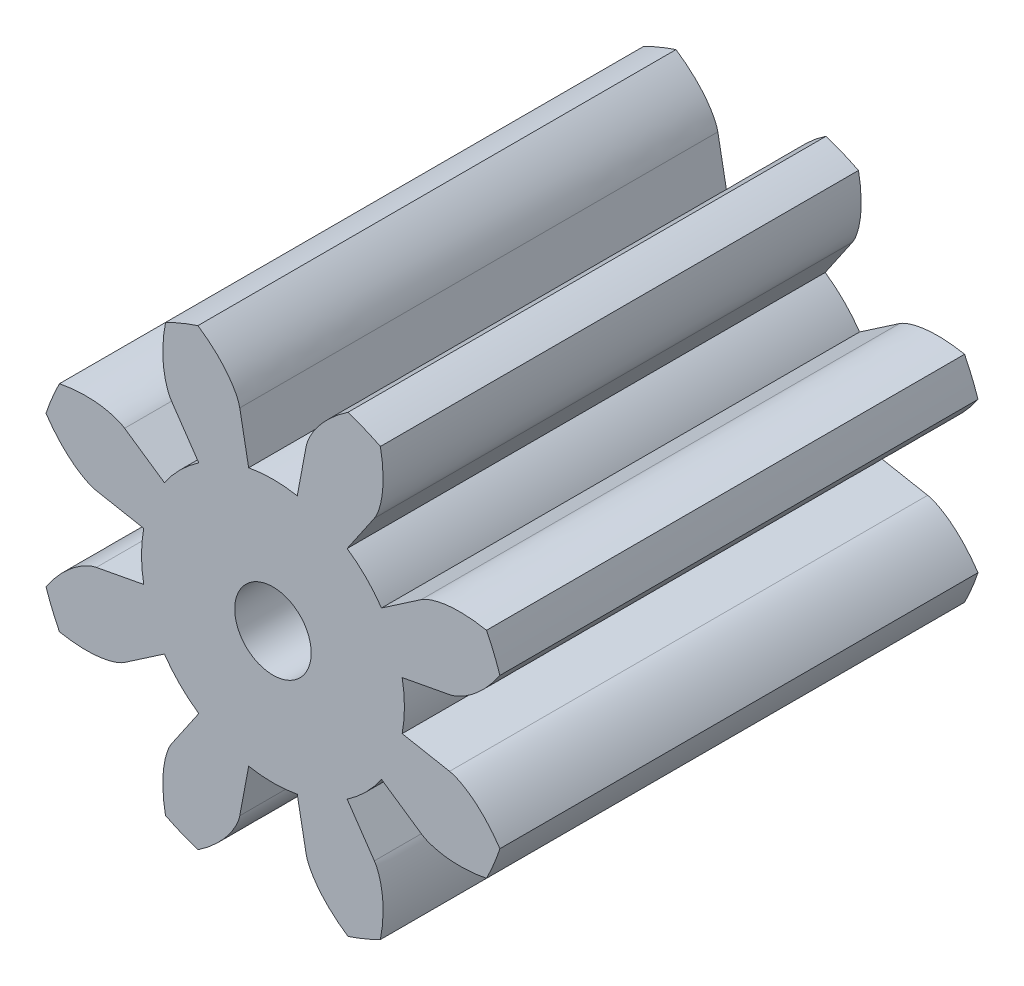
from build123d import *

# Parameters (mm, degrees)
SKETCH_1_R               = 2.5
SKETCH_1_R_2             = 0.4
EXTRUDE_1_DEPTH          = 5
CUT_EXTRUDE_1_DEPTH      = 7.123724357
PATTERN_CIRCULAR_1_COUNT = 8
PATTERN_CIRCULAR_1_ANGLE = 315


with BuildPart() as part:
    # 草图1 → 凸台-拉伸1 (new body)
    with BuildSketch(Plane.XY):
        Circle(SKETCH_1_R)
        Circle(SKETCH_1_R_2, mode=Mode.SUBTRACT)
    extrude(amount=EXTRUDE_1_DEPTH)

    # 草图1<3> → 切除-拉伸1 (cut, through all)
    with BuildSketch(Plane.XY):
        with BuildLine():
            Line((1.847026432, 0.347249544), (1.351325576, 0.254055481))
            ThreePointArc((1.351325576, 0.254055481), (1.369068601, 0.12757808), (1.375, 0))
            ThreePointArc((1.375, 0), (1.369068601, -0.12757808), (1.351325576, -0.254055481))
            Line((1.351325576, -0.254055481), (1.847026432, -0.347249544))
            add(Edge.make_bspline(
                [(1.847026432, -0.347249544), (1.861105815, -0.349896533), (1.899846632, -0.360209619), (1.970159049, -0.391304701), (2.076110666, -0.456854939), (2.198376283, -0.561933061), (2.287354747, -0.663514591), (2.345519616, -0.74289876), (2.373622919, -0.784802038)],
                knots=[0, 0, 0, 0, 0, 0.005604068, 0.015718248, 0.029959916, 0.048733667, 0.068515919, 0.068515919, 0.068515919, 0.068515919, 0.068515919], degree=4))
            ThreePointArc((2.373622919, -0.784802038), (2.468203527, -0.3974561), (2.5, 0))
            ThreePointArc((2.5, 0), (2.468203527, 0.3974561), (2.373622919, 0.784802038))
            add(Edge.make_bspline(
                [(1.847026432, 0.347249544), (1.861105815, 0.349896533), (1.899846632, 0.360209619), (1.970159049, 0.391304701), (2.076110666, 0.456854939), (2.198376283, 0.561933061), (2.287354747, 0.663514591), (2.345519616, 0.74289876), (2.373622919, 0.784802038)],
                knots=[0, 0, 0, 0, 0, 0.005604068, 0.015718248, 0.029959916, 0.048733667, 0.068515919, 0.068515919, 0.068515919, 0.068515919, 0.068515919], degree=4))
        make_face()
    cut_extrude_1 = extrude(amount=CUT_EXTRUDE_1_DEPTH, mode=Mode.SUBTRACT)

    # 阵列(圆周)1: 切除-拉伸1 ×8 about axis
    pattern_circular_1_axis = Axis((0, 0, 5), (0, 0, 1))
    for i in range(1, PATTERN_CIRCULAR_1_COUNT):
        add(cut_extrude_1.rotate(pattern_circular_1_axis, i * PATTERN_CIRCULAR_1_ANGLE / (PATTERN_CIRCULAR_1_COUNT - 1)), mode=Mode.SUBTRACT)


solid = part.part
